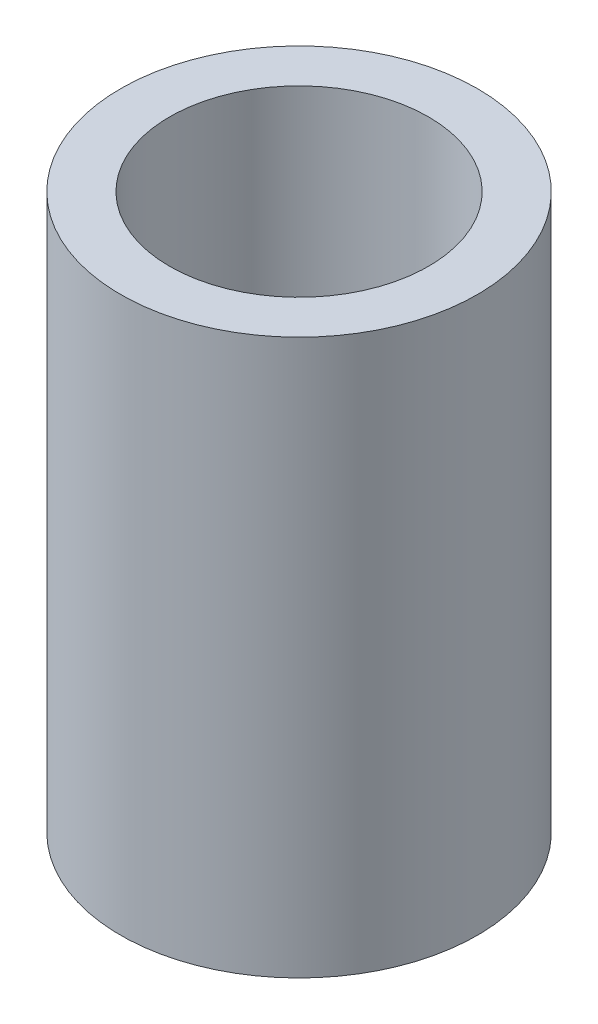
from build123d import *

# Parameters (mm, degrees)
SKETCH1_R           = 6.75
BOSS_EXTRUDE1_DEPTH = 21
SKETCH2_R           = 4.9
CUT_EXTRUDE1_DEPTH  = 10
CUT_EXTRUDE2_DEPTH  = 8


with BuildPart() as part:
    # Sketch1 → Boss-Extrude1 (new body)
    with BuildSketch(Plane(origin=(0, 0, 0), x_dir=(1, 0, 0), z_dir=(0, 1, 0))):
        Circle(SKETCH1_R)
    extrude(amount=BOSS_EXTRUDE1_DEPTH)

    # Sketch2 → Cut-Extrude1 (cut)
    with BuildSketch(Plane(origin=(0, 21, 0), x_dir=(1, 0, 0), z_dir=(0, 1, 0))):
        Circle(SKETCH2_R)
    extrude(amount=-CUT_EXTRUDE1_DEPTH, mode=Mode.SUBTRACT)

    # Sketch3 → Cut-Extrude2 (cut)
    with BuildSketch(Plane.XZ):
        with BuildLine():
            Line((-1.29747386, -1.098435971), (1.29747386, -1.098435971))
            ThreePointArc((1.29747386, -1.098435971), (0, 1.7), (-1.29747386, -1.098435971))
        make_face()
    extrude(amount=-CUT_EXTRUDE2_DEPTH, mode=Mode.SUBTRACT)


solid = part.part
